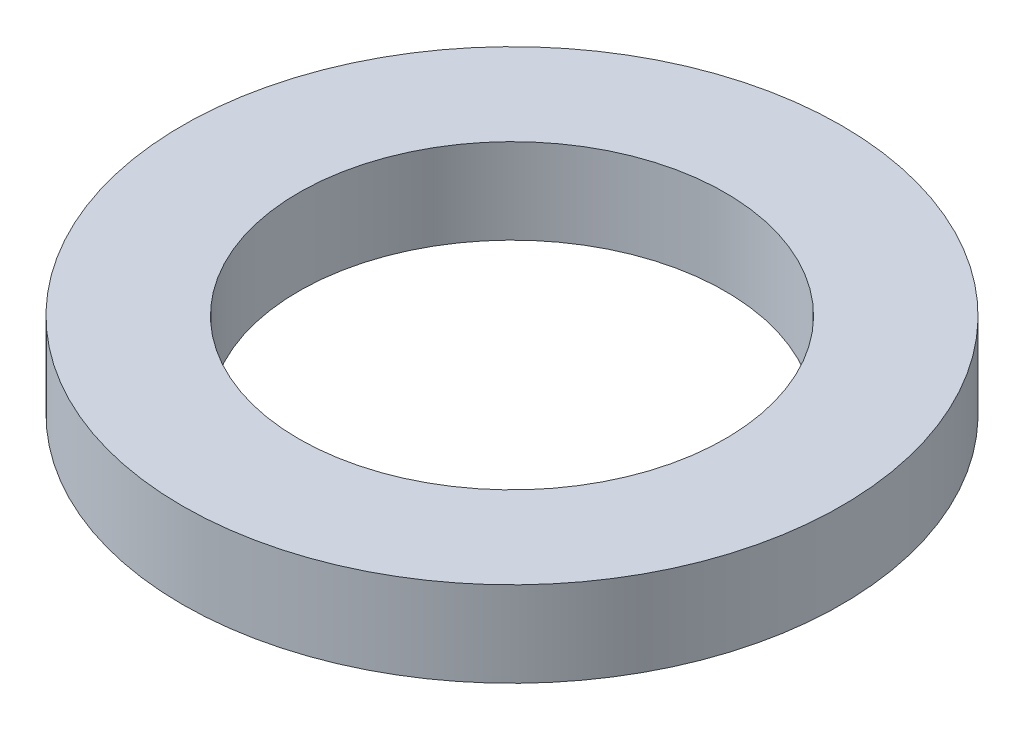
from build123d import *

# Parameters (mm, degrees)
SKETCH1_R           = 42.5
BOSS_EXTRUDE1_DEPTH = 11
SKETCH2_R           = 27.5
CUT_EXTRUDE1_DEPTH  = 62.102373113


with BuildPart() as part:
    # Sketch1 → Boss-Extrude1 (new body)
    with BuildSketch(Plane(origin=(0, 0, 0), x_dir=(1, 0, 0), z_dir=(0, 1, 0))):
        Circle(SKETCH1_R)
    extrude(amount=BOSS_EXTRUDE1_DEPTH)

    # Sketch2 → Cut-Extrude1 (cut, through all)
    with BuildSketch(Plane(origin=(0, 0, 0), x_dir=(1, 0, 0), z_dir=(0, 1, 0))):
        Circle(SKETCH2_R)
    extrude(amount=CUT_EXTRUDE1_DEPTH, mode=Mode.SUBTRACT)


solid = part.part
